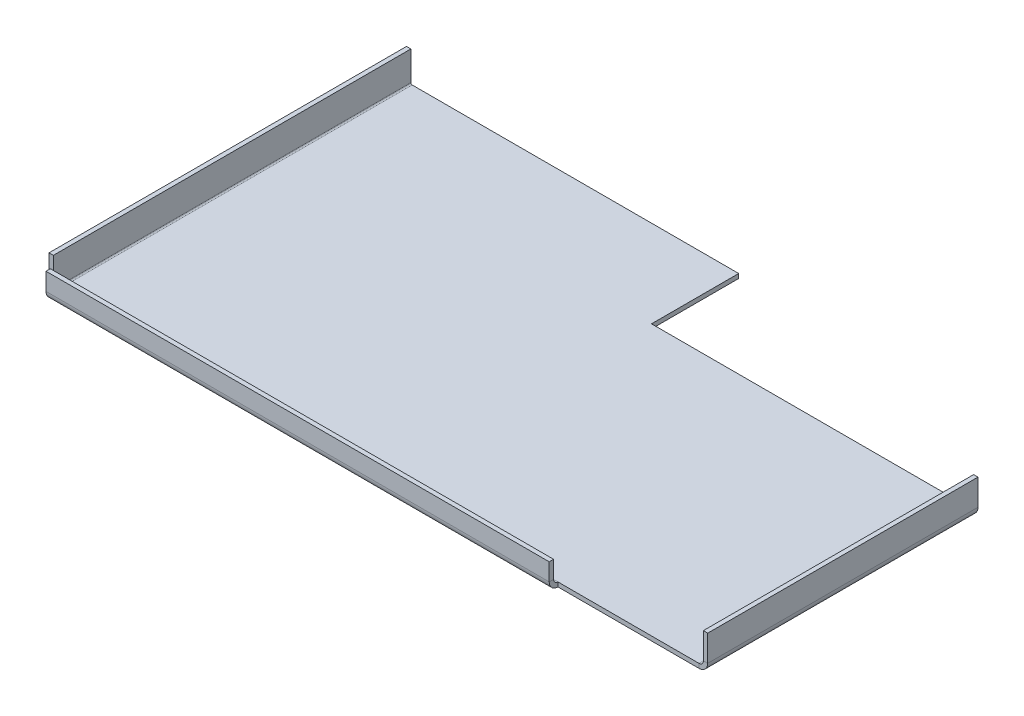
from build123d import *

# Parameters (mm, degrees)
SKETCH5_W                    = 475.54896
SKETCH5_H                    = 260.35
BASE_FLANGE1_DEPTH           = 3.175
EDGE_FLANGE1_DEPTH           = 366.48136
EDGE_FLANGE2_STRIP_W         = 19.05
EDGE_FLANGE2_STRIP_H         = 3.175
EDGE_FLANGE2_STRIP_CUT_DEPTH = 260.35
EDGE_FLANGE2_DEPTH           = 260.35
EDGE_FLANGE3_DEPTH           = 260.35
CUT_EXTRUDE1_DEPTH           = 279.698003441
CUT_EXTRUDE1_DEPTH_BACK      = 279.698003441
SKETCH16_W                   = 336.938395151
SKETCH16_H                   = 122.280894257


# Sheet-metal steps are written as plain solids
with BuildPart() as part:
    # Sketch5 → Base-Flange1 (new body)
    with BuildSketch(Plane(origin=(0, 0, 0), x_dir=(1, 0, 0), z_dir=(0, 1, 0))):
        Rectangle(SKETCH5_W, SKETCH5_H)
    extrude(amount=-BASE_FLANGE1_DEPTH)

    # Edge-Flange1 section (across the edge) → Edge-Flange1 (add)
    with BuildSketch(Plane(origin=(-237.77448, 0, 133.35), x_dir=(0, 0, -1), z_dir=(1, 0, 0))):
        with BuildLine():
            Line((-3.175, 3.175), (-3.175, 15.875))
            Line((-3.175, 15.875), (0, 15.875))
            Line((0, 15.875), (0, 3.175))
            ThreePointArc((0, 3.175), (0.92993597, 0.92993597), (3.175, 0))
            Line((3.175, 0), (3.175, -3.175))
            ThreePointArc((3.175, -3.175), (-1.315128061, -1.315128061), (-3.175, 3.175))
        make_face()
    extrude(amount=EDGE_FLANGE1_DEPTH)

    # Edge-Flange2 strip (across the edge) → Edge-Flange2 strip cut (cut)
    with BuildSketch(Plane(origin=(237.77448, 0, 130.175), x_dir=(-1, 0, 0), z_dir=(0, 0, -1))):
        with Locations((-3.175, -1.5875)):
            Rectangle(EDGE_FLANGE2_STRIP_W, EDGE_FLANGE2_STRIP_H)
    extrude(amount=EDGE_FLANGE2_STRIP_CUT_DEPTH, mode=Mode.SUBTRACT)

    # Edge-Flange2 section (across the edge) → Edge-Flange2 (add)
    with BuildSketch(Plane(origin=(237.77448, 0, 130.175), x_dir=(-1, 0, 0), z_dir=(0, 0, -1))):
        with BuildLine():
            Line((0, 3.175), (0, 22.225))
            Line((0, 22.225), (3.175, 22.225))
            Line((3.175, 22.225), (3.175, 3.175))
            ThreePointArc((3.175, 3.175), (4.10493597, 0.92993597), (6.35, 0))
            Line((6.35, 0), (6.35, -3.175))
            ThreePointArc((6.35, -3.175), (1.859871939, -1.315128061), (0, 3.175))
        make_face()
    extrude(amount=EDGE_FLANGE2_DEPTH)

    # Edge-Flange3 section (across the edge) → Edge-Flange3 (add)
    with BuildSketch(Plane(origin=(-238.77448, 0, -130.175), x_dir=(1, 0, 0), z_dir=(0, 0, 1))):
        with BuildLine():
            Line((-3.175, 1), (-3.175, 22.225))
            Line((-3.175, 22.225), (0, 22.225))
            Line((0, 22.225), (0, 1))
            ThreePointArc((0, 1), (0.292893219, 0.292893219), (1, 0))
            Line((1, 0), (1, -3.175))
            ThreePointArc((1, -3.175), (-1.952170811, -1.952170811), (-3.175, 1))
        make_face()
    extrude(amount=EDGE_FLANGE3_DEPTH)

    # Sketch16 → Cut-Extrude1 (cut, two sides: drawn at the far end of the back side and taken through both)
    with BuildSketch(Plane(origin=(0, 0, 0), x_dir=(1, 0, 0), z_dir=(0, 1, 0)).offset(-CUT_EXTRUDE1_DEPTH_BACK)):
        with Locations((168.469197576, 127.815447129)):
            Rectangle(SKETCH16_W, SKETCH16_H)
    extrude(amount=CUT_EXTRUDE1_DEPTH + CUT_EXTRUDE1_DEPTH_BACK, mode=Mode.SUBTRACT)


solid = part.part
